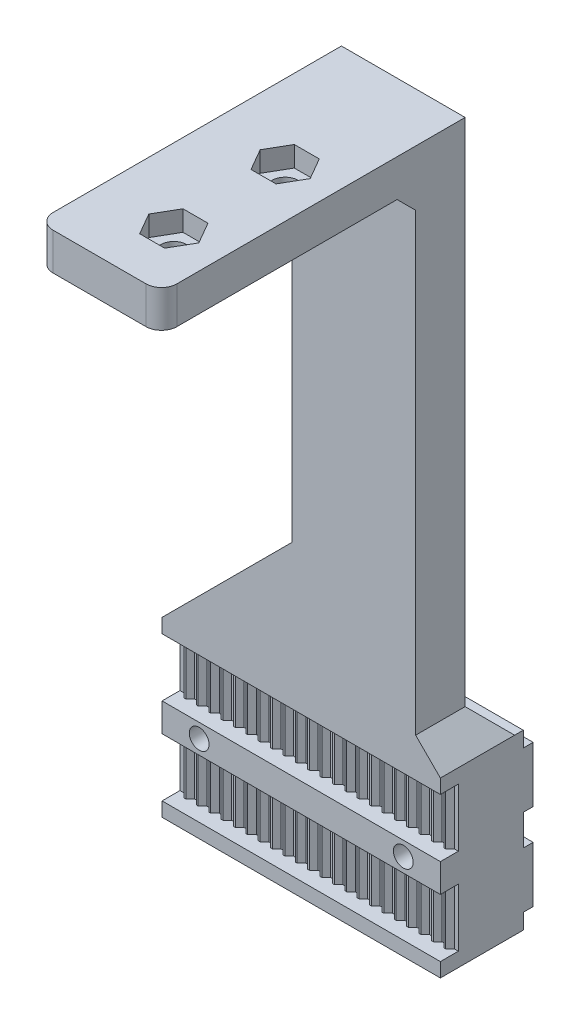
from build123d import *

# Parameters (mm, degrees)
SKETCH_1_W          = 45
SKETCH_1_H          = 28
EXTRUDE_1_DEPTH     = 13.4
EXTRUDE_START       = -2.5
SKETCH_2_W          = 45
SKETCH_2_H          = 1.6
EXTRUDE_2_DEPTH     = 9
EXTRUDE_START_2     = -16.5
SKETCH_2_2_W        = 45
SKETCH_2_2_H        = 1.6
EXTRUDE_3_DEPTH     = 9
SKETCH_3_W          = 45
SKETCH_3_H          = 9.4
CUT_EXTRUDE_1_DEPTH = 2.9
SKETCH_4_R          = 1.6
CUT_EXTRUDE_2_DEPTH = 56.081757416
EXTRUDE_4_DEPTH     = 9.4
EXTRUDE_START_3     = 14
EXTRUDE_5_DEPTH     = 9.4
EXTRUDE_16_DEPTH    = 8
SKETCH_18_W         = 20
SKETCH_18_H         = 49.1
EXTRUDE_17_DEPTH    = 6
SKETCH_19_R         = 2.1
CUT_EXTRUDE_5_DEPTH = 135.556679507
CUT_EXTRUDE_6_DEPTH = 3.3
CHAMFER_1_SIZE      = 4
CHAMFER_2_SIZE      = 3
FILLET_1_R          = 2.5


with BuildPart() as part:
    # Эскиз1 → Бобышка-Вытянуть1 (new body)
    with BuildSketch(Plane.XY):
        with Locations((-22.5, -14)):
            Rectangle(SKETCH_1_W, SKETCH_1_H)
    extrude(amount=EXTRUDE_1_DEPTH)

    # Эскиз2 → Бобышка-Вытянуть2 (add)
    with BuildSketch(Plane(origin=(0, 0, 0), x_dir=(1, 0, 0), z_dir=(0, 1, 0)).offset(EXTRUDE_START)):
        with Locations((-22.5, 0.8)):
            Rectangle(SKETCH_2_W, SKETCH_2_H)
    extrude(amount=-EXTRUDE_2_DEPTH)

    # Эскиз2<2> → Бобышка-Вытянуть3 (add)
    with BuildSketch(Plane(origin=(0, 0, 0), x_dir=(1, 0, 0), z_dir=(0, 1, 0)).offset(EXTRUDE_START_2)):
        with Locations((-22.5, 0.8)):
            Rectangle(SKETCH_2_2_W, SKETCH_2_2_H)
    extrude(amount=-EXTRUDE_3_DEPTH)

    # Эскиз3 → Вырез-Вытянуть1 (cut)
    with BuildSketch(Plane.XY.offset(13.4)):
        with Locations((-22.5, -7)):
            Rectangle(SKETCH_3_W, SKETCH_3_H)
        with Locations((-22.5, -21)):
            Rectangle(SKETCH_3_W, SKETCH_3_H)
    extrude(amount=-CUT_EXTRUDE_1_DEPTH, mode=Mode.SUBTRACT)

    # Эскиз4 → Вырез-Вытянуть2 (cut, through all)
    with BuildSketch(Plane.XY.offset(13.4)):
        with Locations((-39, -14)):
            Circle(SKETCH_4_R)
        with Locations((-6, -14)):
            Circle(SKETCH_4_R)
    extrude(amount=-CUT_EXTRUDE_2_DEPTH, mode=Mode.SUBTRACT)

    # Эскиз5 → Бобышка-Вытянуть4 (add)
    with BuildSketch(Plane.XZ.offset(2.3)):
        Polygon((-45, 10.5), (-44.35, 10.5), (-43.65, 11.2), (-43.35, 11.2), (-42.65, 10.5), (-42.35, 10.5), (-41.65, 11.2), (-41.35, 11.2), (-40.65, 10.5), (-40.35, 10.5), (-39.65, 11.2), (-39.35, 11.2), (-38.65, 10.5), (-38.35, 10.5), (-37.65, 11.2), (-37.35, 11.2), (-36.65, 10.5), (-36.35, 10.5), (-35.65, 11.2), (-35.35, 11.2), (-34.65, 10.5), (-34.35, 10.5), (-33.65, 11.2), (-33.35, 11.2), (-32.65, 10.5), (-32.35, 10.5), (-31.65, 11.2), (-31.35, 11.2), (-30.65, 10.5), (-30.35, 10.5), (-29.65, 11.2), (-29.35, 11.2), (-28.65, 10.5), (-28.35, 10.5), (-27.65, 11.2), (-27.35, 11.2), (-26.65, 10.5), (-26.35, 10.5), (-25.65, 11.2), (-25.35, 11.2), (-24.65, 10.5), (-24.35, 10.5), (-23.65, 11.2), (-23.35, 11.2), (-22.65, 10.5), (-22.35, 10.5), (-21.65, 11.2), (-21.35, 11.2), (-20.65, 10.5), (-20.35, 10.5), (-19.65, 11.2), (-19.35, 11.2), (-18.65, 10.5), (-18.35, 10.5), (-17.65, 11.2), (-17.35, 11.2), (-16.65, 10.5), (-16.35, 10.5), (-15.65, 11.2), (-15.35, 11.2), (-14.65, 10.5), (-14.35, 10.5), (-13.65, 11.2), (-13.35, 11.2), (-12.65, 10.5), (-12.35, 10.5), (-11.65, 11.2), (-11.35, 11.2), (-10.65, 10.5), (-10.35, 10.5), (-9.65, 11.2), (-9.35, 11.2), (-8.65, 10.5), (-8.35, 10.5), (-7.65, 11.2), (-7.35, 11.2), (-6.65, 10.5), (-6.35, 10.5), (-5.65, 11.2), (-5.35, 11.2), (-4.65, 10.5), (-4.35, 10.5), (-3.65, 11.2), (-3.35, 11.2), (-2.65, 10.5), (-2.35, 10.5), (-1.65, 11.2), (-1.35, 11.2), (-0.65, 10.5), (0, 10.5), (0, 9.5), (-45, 9.5), align=None)
    extrude(amount=EXTRUDE_4_DEPTH)

    # Эскиз5<2> → Бобышка-Вытянуть5 (add)
    with BuildSketch(Plane.XZ.offset(2.3).offset(EXTRUDE_START_3)):
        Polygon((-45, 10.5), (-44.35, 10.5), (-43.65, 11.2), (-43.35, 11.2), (-42.65, 10.5), (-42.35, 10.5), (-41.65, 11.2), (-41.35, 11.2), (-40.65, 10.5), (-40.35, 10.5), (-39.65, 11.2), (-39.35, 11.2), (-38.65, 10.5), (-38.35, 10.5), (-37.65, 11.2), (-37.35, 11.2), (-36.65, 10.5), (-36.35, 10.5), (-35.65, 11.2), (-35.35, 11.2), (-34.65, 10.5), (-34.35, 10.5), (-33.65, 11.2), (-33.35, 11.2), (-32.65, 10.5), (-32.35, 10.5), (-31.65, 11.2), (-31.35, 11.2), (-30.65, 10.5), (-30.35, 10.5), (-29.65, 11.2), (-29.35, 11.2), (-28.65, 10.5), (-28.35, 10.5), (-27.65, 11.2), (-27.35, 11.2), (-26.65, 10.5), (-26.35, 10.5), (-25.65, 11.2), (-25.35, 11.2), (-24.65, 10.5), (-24.35, 10.5), (-23.65, 11.2), (-23.35, 11.2), (-22.65, 10.5), (-22.35, 10.5), (-21.65, 11.2), (-21.35, 11.2), (-20.65, 10.5), (-20.35, 10.5), (-19.65, 11.2), (-19.35, 11.2), (-18.65, 10.5), (-18.35, 10.5), (-17.65, 11.2), (-17.35, 11.2), (-16.65, 10.5), (-16.35, 10.5), (-15.65, 11.2), (-15.35, 11.2), (-14.65, 10.5), (-14.35, 10.5), (-13.65, 11.2), (-13.35, 11.2), (-12.65, 10.5), (-12.35, 10.5), (-11.65, 11.2), (-11.35, 11.2), (-10.65, 10.5), (-10.35, 10.5), (-9.65, 11.2), (-9.35, 11.2), (-8.65, 10.5), (-8.35, 10.5), (-7.65, 11.2), (-7.35, 11.2), (-6.65, 10.5), (-6.35, 10.5), (-5.65, 11.2), (-5.35, 11.2), (-4.65, 10.5), (-4.35, 10.5), (-3.65, 11.2), (-3.35, 11.2), (-2.65, 10.5), (-2.35, 10.5), (-1.65, 11.2), (-1.35, 11.2), (-0.65, 10.5), (0, 10.5), (0, 9.5), (-45, 9.5), align=None)
    extrude(amount=EXTRUDE_5_DEPTH)

    # Эскиз17 → Бобышка-Вытянуть16 (add)
    with BuildSketch(Plane(origin=(0, -13.4, 13.4), x_dir=(1, 0, 0), z_dir=(0, 0, -1))):
        Polygon((-4, -13.4), (-45, -13.4), (-24, -34.4), (-24, -99.9), (-4, -99.9), align=None)
    extrude(amount=EXTRUDE_16_DEPTH)

    # Эскиз18 → Бобышка-Вытянуть17 (add)
    with BuildSketch(Plane(origin=(0, 86.5, 85.9), x_dir=(1, 0, 0), z_dir=(0, -1, 0))):
        with Locations((-14, -55.95)):
            Rectangle(SKETCH_18_W, SKETCH_18_H)
    extrude(amount=EXTRUDE_17_DEPTH)

    # Эскиз19 → Вырез-Вытянуть5 (cut, through all)
    with BuildSketch(Plane(origin=(0, 86.5, 0), x_dir=(-1, 0, 0), z_dir=(0, -1, 0))):
        with Locations(Location((12, -26.5, 0), (0, 0, 180))):
            Circle(SKETCH_19_R)
        with Locations(Location((12, -44.5, 0), (0, 0, 180))):
            Circle(SKETCH_19_R)
    extrude(amount=CUT_EXTRUDE_5_DEPTH, mode=Mode.SUBTRACT)

    # Эскиз20 → Вырез-Вытянуть6 (cut)
    with BuildSketch(Plane(origin=(0, 86.5, 0), x_dir=(-1, 0, 0), z_dir=(0, 1, 0))):
        Polygon((16.041451884, 26.5), (14.020725942, 30), (9.979274058, 30), (7.958548116, 26.5), (9.979274058, 23), (14.020725942, 23), align=None)
        Polygon((16.041451884, 44.5), (14.020725942, 48), (9.979274058, 48), (7.958548116, 44.5), (9.979274058, 41), (14.020725942, 41), align=None)
    extrude(amount=-CUT_EXTRUDE_6_DEPTH, mode=Mode.SUBTRACT)

    # Фаска1
    chamfer_1_edges = [part.edges().sort_by_distance(p)[0] for p in [
        (-24.5, 0, 5.4),
        (-4, 0, 9.4),
    ]]
    chamfer(chamfer_1_edges, length=CHAMFER_1_SIZE - 0.0001)  # a hair under: the kernel refuses the full size

    # Фаска2
    chamfer_2_edges = [part.edges().sort_by_distance(p)[0] for p in [
        (-14, 80.5, 13.4),
    ]]
    chamfer(chamfer_2_edges, length=CHAMFER_2_SIZE)

    # Скругление1
    fillet_1_edges = [part.edges().sort_by_distance(p)[0] for p in [
        (-4, 83.5, 54.5),
        (-24, 83.5, 54.5),
    ]]
    fillet(fillet_1_edges, radius=FILLET_1_R)


solid = part.part
